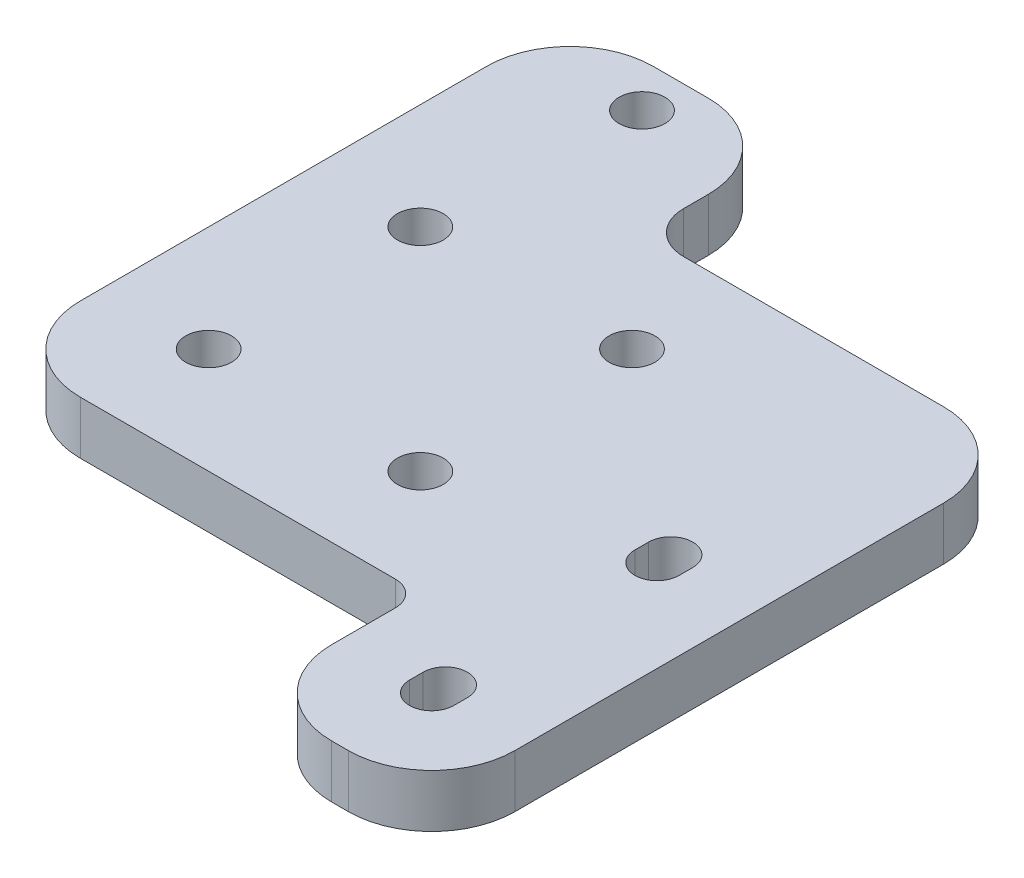
from build123d import *

# Parameters (mm, degrees)
BOSS_EXTRUDE1_DEPTH  = 6.35
M5_CLEARANCE_HOLE1_D = 5.5
CUT_EXTRUDE2_DEPTH   = 67.383462549
FILLET1_R            = 10
FILLET2_R            = 3
FILLET3_R            = 5


with BuildPart() as part:
    # Sketch1 → Boss-Extrude1 (new body)
    with BuildSketch(Plane(origin=(0, 0, 0), x_dir=(1, 0, 0), z_dir=(0, 1, 0))):
        Polygon((25.4, -25.4), (-25.4, -25.4), (-25.4, 25.4), (-25.4, 43.35), (1.2, 43.35), (1.2, 25.4), (25.4, 25.4), (47.4, 25.4), (47.4, -46.04), (36.4, -46.04), (25.4, -46.04), align=None)
    extrude(amount=BOSS_EXTRUDE1_DEPTH)

    # M5 Clearance Hole1 (through all)
    with Locations(Plane(origin=(0, 6.35, 0), x_dir=(1, 0, 0), z_dir=(0, 1, 0))):
        with Locations((-12.7, 12.7), (12.7, 12.7), (12.7, -12.7), (-12.7, -12.7), (-11.5, 38.1)):
            Hole(M5_CLEARANCE_HOLE1_D / 2)

    # Sketch7 → Cut-Extrude2 (cut, through all)
    with BuildSketch(Plane(origin=(0, 6.35, 0), x_dir=(1, 0, 0), z_dir=(0, 1, 0))):
        with BuildLine():
            Line((33.75, -33.4), (33.75, -35.04))
            ThreePointArc((33.75, -35.04), (36.4, -37.69), (39.05, -35.04))
            Line((39.05, -35.04), (39.05, -33.4))
            ThreePointArc((39.05, -33.4), (36.4, -30.75), (33.75, -33.4))
        make_face()
        with BuildLine():
            Line((33.75, -6.36), (33.75, -8))
            ThreePointArc((33.75, -8), (36.4, -10.65), (39.05, -8))
            Line((39.05, -8), (39.05, -6.36))
            ThreePointArc((39.05, -6.36), (36.4, -3.71), (33.75, -6.36))
        make_face()
    extrude(amount=-CUT_EXTRUDE2_DEPTH, mode=Mode.SUBTRACT)

    # Fillet1
    fillet1_edges = [part.edges().sort_by_distance(p)[0] for p in [
        (47.4, 3.175, 46.04),
        (47.4, 3.175, -25.4),
        (-25.4, 3.175, 25.4),
        (-25.4, 3.175, -43.35),
        (1.2, 3.175, -43.35),
        (25.4, 3.175, 46.04),
    ]]
    fillet(fillet1_edges, radius=FILLET1_R)

    # Fillet2
    fillet2_edges = [part.edges().sort_by_distance(p)[0] for p in [
        (25.4, 3.175, 25.4),
    ]]
    fillet(fillet2_edges, radius=FILLET2_R)

    # Fillet3
    fillet3_edges = [part.edges().sort_by_distance(p)[0] for p in [
        (1.2, 3.175, -25.4),
    ]]
    fillet(fillet3_edges, radius=FILLET3_R)


solid = part.part
